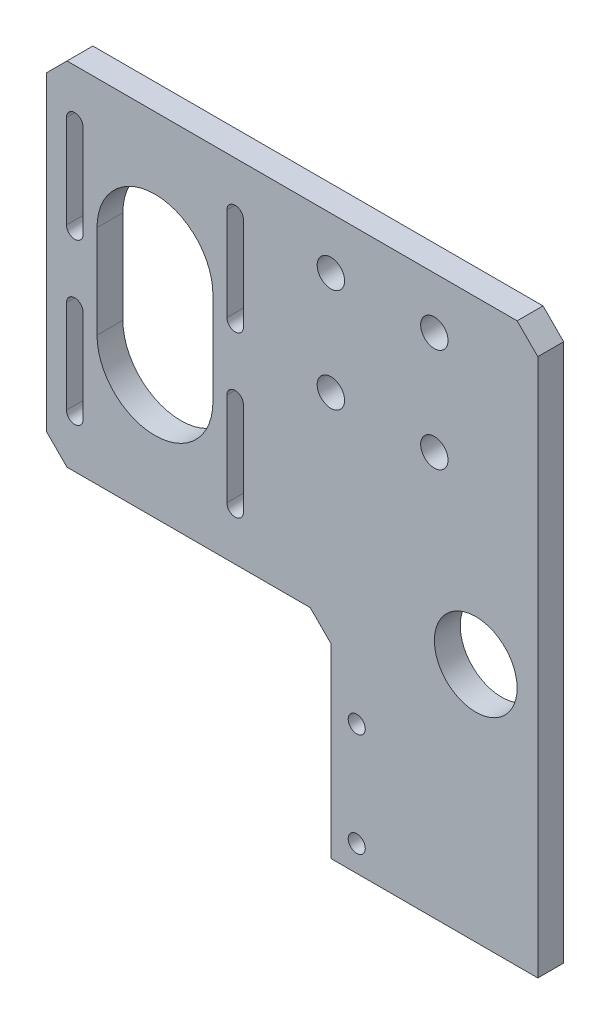
from build123d import *

# Parameters (mm, degrees)
SKETCH_1_W          = 95
SKETCH_1_H          = 68
EXTRUDE_1_DEPTH     = 5
HOLE_WIZARD_M5_1_D  = 5.3
CUT_EXTRUDE_2_DEPTH = 59.628064952
SKETCH_8_W          = 40
SKETCH_8_H          = 5
EXTRUDE_2_DEPTH     = 40
SKETCH_4_R          = 8
CUT_EXTRUDE_1_DEPTH = 89.075251916
CHAMFER_1_SIZE      = 4
M4X0_7_1_D          = 3.3


with BuildPart() as part:
    # 草圖1 → 填料-伸長1 (new body)
    with BuildSketch(Plane.XY):
        Rectangle(SKETCH_1_W, SKETCH_1_H)
    extrude(amount=EXTRUDE_1_DEPTH)

    # M5 餘隙孔1 (through all)
    with Locations(Plane.XY.offset(5)):
        with Locations((27.5, 4), (27.5, 24), (7.5, 4), (7.5, 24)):
            Hole(HOLE_WIZARD_M5_1_D / 2)

    # 草圖6 → 除料-伸長2 (cut, through all)
    with BuildSketch(Plane.XY.offset(5)):
        with BuildLine():
            Line((-37.7, -9), (-37.7, 9))
            ThreePointArc((-37.7, 9), (-26.5, 20.2), (-15.3, 9))
            Line((-15.3, 9), (-15.3, -9))
            ThreePointArc((-15.3, -9), (-26.5, -20.2), (-37.7, -9))
        make_face()
        with BuildLine():
            Line((-40.4, 24.5), (-40.4, 6.5))
            ThreePointArc((-40.4, 6.5), (-42, 4.9), (-43.6, 6.5))
            Line((-43.6, 6.5), (-43.6, 24.5))
            ThreePointArc((-43.6, 24.5), (-42, 26.1), (-40.4, 24.5))
        make_face()
        with BuildLine():
            Line((-9.4, 24.5), (-9.4, 6.5))
            ThreePointArc((-9.4, 6.5), (-11, 4.9), (-12.6, 6.5))
            Line((-12.6, 6.5), (-12.6, 24.5))
            ThreePointArc((-12.6, 24.5), (-11, 26.1), (-9.4, 24.5))
        make_face()
        with BuildLine():
            Line((-9.4, -6.5), (-9.4, -24.5))
            ThreePointArc((-9.4, -24.5), (-11, -26.1), (-12.6, -24.5))
            Line((-12.6, -24.5), (-12.6, -6.5))
            ThreePointArc((-12.6, -6.5), (-11, -4.9), (-9.4, -6.5))
        make_face()
        with BuildLine():
            Line((-40.4, -6.5), (-40.4, -24.5))
            ThreePointArc((-40.4, -24.5), (-42, -26.1), (-43.6, -24.5))
            Line((-43.6, -24.5), (-43.6, -6.5))
            ThreePointArc((-43.6, -6.5), (-42, -4.9), (-40.4, -6.5))
        make_face()
    extrude(amount=-CUT_EXTRUDE_2_DEPTH, mode=Mode.SUBTRACT)

    # 草圖8 → 填料-伸長2 (add)
    with BuildSketch(Plane.XZ.offset(34)):
        with Locations((27.5, 2.5)):
            Rectangle(SKETCH_8_W, SKETCH_8_H)
    extrude(amount=EXTRUDE_2_DEPTH)

    # 草圖4 → 除料-伸長1 (cut, through all)
    with BuildSketch(Plane.XY.offset(5)):
        with Locations((35.5, -27.5)):
            Circle(SKETCH_4_R)
    extrude(amount=-CUT_EXTRUDE_1_DEPTH, mode=Mode.SUBTRACT)

    # 導角1
    chamfer_1_edges = [part.edges().sort_by_distance(p)[0] for p in [
        (7.5, -34, 2.5),
        (-47.5, -34, 2.5),
        (47.5, 34, 2.5),
        (-47.5, 34, 2.5),
    ]]
    chamfer(chamfer_1_edges, length=CHAMFER_1_SIZE)

    # M4x0.7 螺紋孔1 (through all)
    with Locations(Plane.XY.offset(5)):
        with Locations((12.5, -49), (12.5, -69)):
            Hole(M4X0_7_1_D / 2)


solid = part.part
